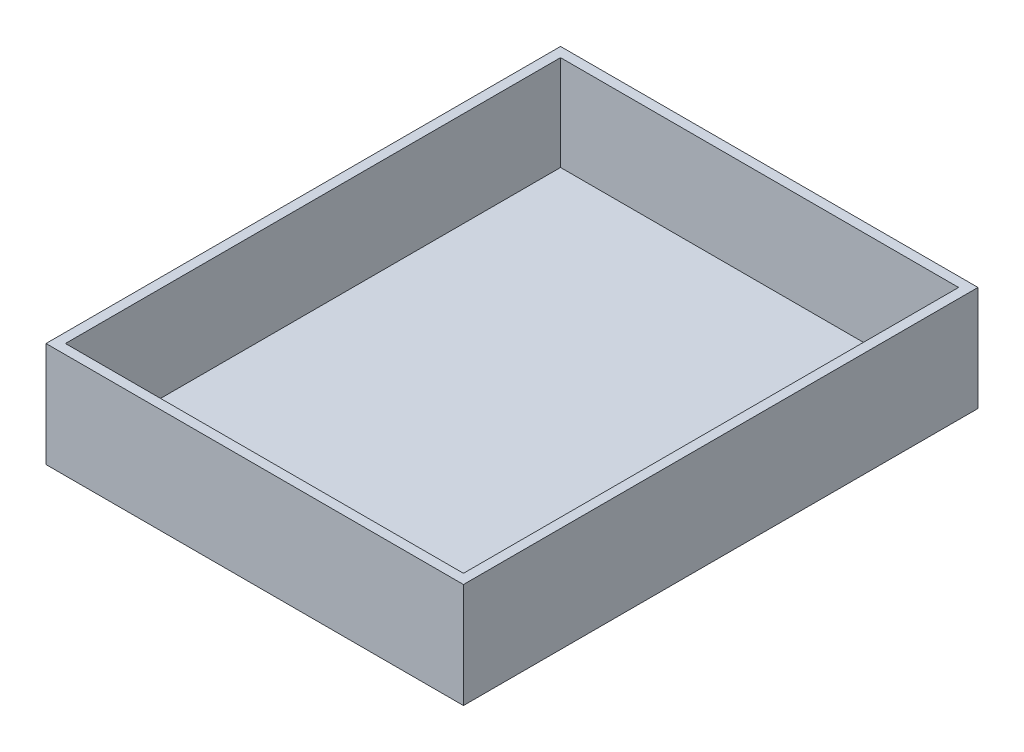
from build123d import *

# Parameters (mm, degrees)
BASE_W              = 82
BASE_H              = 102
BOSS_EXTRUDE1_DEPTH = 19.6
SHELL2_T            = 2


with BuildPart() as part:
    # Base → Boss-Extrude1 (new body)
    with BuildSketch(Plane(origin=(0, 0, 0), x_dir=(1, 0, 0), z_dir=(0, 1, 0))):
        Rectangle(BASE_W, BASE_H)
    extrude(amount=BOSS_EXTRUDE1_DEPTH)

    # Shell2
    shell2_openings = [part.faces().sort_by_distance(p)[0] for p in [
        (0, 19.6, 0),
    ]]
    offset(amount=SHELL2_T, openings=shell2_openings, kind=Kind.INTERSECTION)


solid = part.part
